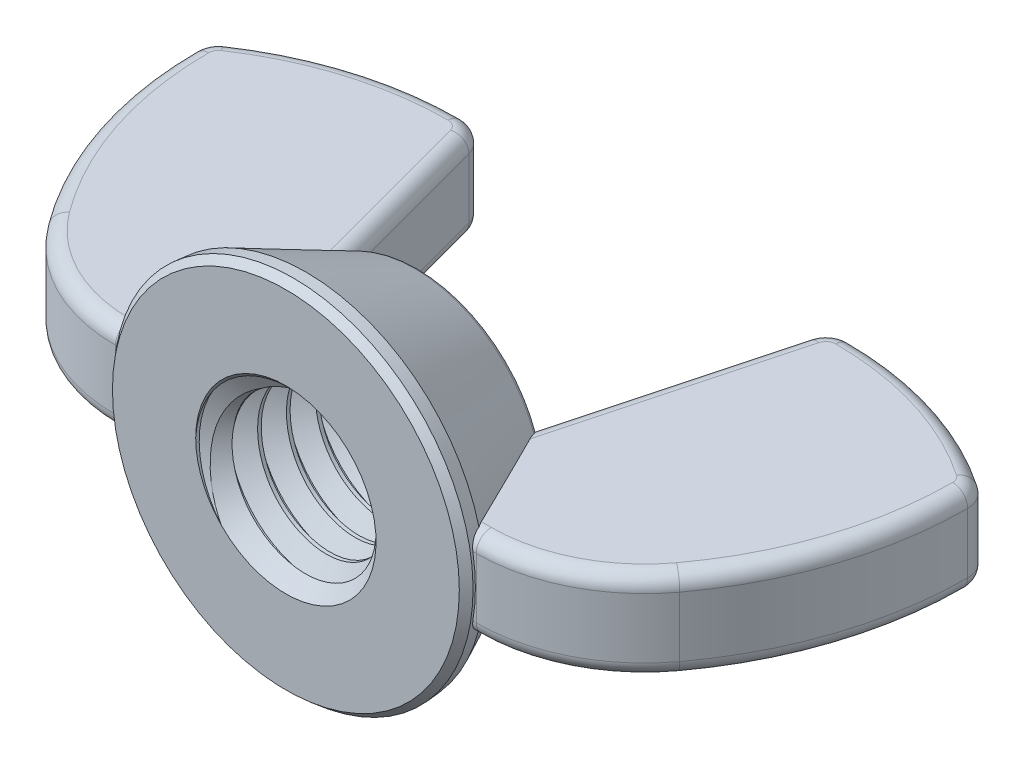
from build123d import *

# Parameters (mm, degrees)
EXTRUDE2_DEPTH     = 1.25
SKETCH3_R          = 5
EXTRUDE1_DEPTH     = 0.55566
EXTRUDE1_DRAFT     = -5
SKETCH15_R         = 4.951386049
EXTRUDE3_DEPTH     = 3.14874
EXTRUDE3_TAPER     = 25.210033151
FILLET3_R          = 0.254
SKETCH4_R          = 2.5
CUT_EXTRUDE1_DEPTH = 16.684929072
SWEEP1_PITCH       = 0.8
SKETCH7_R          = 5
CUT_EXTRUDE2_DEPTH = 16.684929104
SKETCH8_R          = 4.951386049
CUT_EXTRUDE3_DEPTH = 14.546328962
SKETCH11_R         = 2.4492
CUT_EXTRUDE5_DEPTH = 14.546328926
CUT_EXTRUDE5_TAPER = 45
CHAMFER1_SIZE      = 0.2083725
CHAMFER1_SIZE2     = 0.192340809
FILLET4_R          = 0.416666667


with BuildPart() as part:
    # Sketch13 → Extrude2 (new, symmetric)
    with BuildSketch(Plane(origin=(0, 0, 0), x_dir=(1, 0, 0), z_dir=(0, 1, 0))):
        with BuildLine():
            Line((3.074810737, 0.27783), (5, 0.27783))
            ThreePointArc((5, 0.27783), (7.099129938, 0.776746992), (8.749295866, 2.166789103))
            ThreePointArc((8.749295866, 2.166789103), (10.222034162, 5.009156698), (10.73, 8.169850029))
            ThreePointArc((10.73, 8.169850029), (10.648713606, 8.495871948), (10.423883961, 8.745570566))
            ThreePointArc((10.423883961, 8.745570566), (8.013491694, 9.895268701), (5.372282902, 10.29))
            ThreePointArc((5.372282902, 10.29), (4.94953191, 10.146495375), (4.701501078, 9.775291004))
            Line((4.701501078, 9.775291004), (3.074810737, 3.7044))
            Line((3.074810737, 3.7044), (3.074810737, 0.27783))
        make_face()
    extrude(amount=EXTRUDE2_DEPTH, both=True)

    # Fillet4
    fillet4_edges = [part.edges().sort_by_distance(p)[0] for p in [
        (7.099129938, 1.25, -0.776746992),
        (10.222034162, 1.25, -5.009156698),
        (10.648713606, 1.25, -8.495871948),
        (8.013491694, 1.25, -9.895268701),
        (4.94953191, 1.25, -10.146495375),
        (3.888155907, 1.25, -6.739845502),
        (3.888155907, -1.25, -6.739845502),
        (4.037405368, 1.25, -0.27783),
        (4.94953191, -1.25, -10.146495375),
        (8.013491694, -1.25, -9.895268701),
        (10.648713606, -1.25, -8.495871948),
        (10.222034162, -1.25, -5.009156698),
        (7.099129938, -1.25, -0.776746992),
        (4.037405368, -1.25, -0.27783),
    ]]
    fillet(fillet4_edges, radius=FILLET4_R)


with BuildPart() as body_2:
    # Sketch3 → Extrude1 (with draft: the straight prism first)
    with BuildSketch(Plane.XY):
        Circle(SKETCH3_R)
    extrude(amount=-EXTRUDE1_DEPTH)
    # Extrude1: the draft: its side faces are tilted about the plane it starts from
    extrude1_sides = [body_2.faces().sort_by_distance(p)[0] for p in [
        (-5, 0, -0.27783),
    ]]
    draft(extrude1_sides, Plane.XY, EXTRUDE1_DRAFT)

    # Sketch15 → Extrude3 (add)
    with BuildSketch(Plane(origin=(0, 0, -0.55566), x_dir=(-1, 0, 0), z_dir=(0, 0, -1))):
        Circle(SKETCH15_R)
    extrude(amount=EXTRUDE3_DEPTH, taper=EXTRUDE3_TAPER)

    # Fillet3
    fillet3_edges = [body_2.edges().sort_by_distance(p)[0] for p in [
        (3.469027946, 0, -3.7044),
    ]]
    fillet(fillet3_edges, radius=FILLET3_R)

    # Sketch4 → Cut-Extrude1 (cut, through all)
    with BuildSketch(Plane.XY):
        Circle(SKETCH4_R)
    extrude(amount=-CUT_EXTRUDE1_DEPTH, mode=Mode.SUBTRACT)

    # Sweep1: the profile of Sketch6 profile screwed along a right-hand helix of 7.1305 turns, 6 arcs to a turn; built about Z, then put on its axis
    sweep1_z = Axis((0, 0, 0), (0, 0, 1))
    sweep1_corners = [(2.5003, 0, -0.700173205), (1.980384758, 0, -0.4), (1.980384758, 0, -0.3), (2.5003, 0, 0.000173205)]
    with BuildLine(mode=Mode.PRIVATE) as sweep1_profile:
        Line(sweep1_corners[0], sweep1_corners[1])
        Line(sweep1_corners[1], sweep1_corners[2])
        Line(sweep1_corners[2], sweep1_corners[3])
        Line(sweep1_corners[3], sweep1_corners[0])
    sweep1_cap = Face(sweep1_profile.wire())
    sweep1_turn_angles = [0, 30, 60, 90, 120, 150, 180, 210, 240, 270, 300, 330, 360]
    sweep1_turn_weights = [1, 0.8660254037844387, 1, 0.8660254037844387, 1, 0.8660254037844387, 1, 0.8660254037844387, 1, 0.8660254037844387, 1, 0.8660254037844387, 1]
    sweep1_turn_rails = [Edge.make_bspline([Vector(p[0], p[1], 0).rotate(sweep1_z, sweep1_turn_angles[k]) / sweep1_turn_weights[k] + Vector(0, 0, p[2] + SWEEP1_PITCH * sweep1_turn_angles[k] / 360) for k in range(13)], [0, 0, 0, 1, 1, 2, 2, 3, 3, 4, 4, 5, 5, 6, 6, 6], 2, sweep1_turn_weights) for p in sweep1_corners]
    sweep1_turn_sides = [Face.make_surface_from_curves(sweep1_turn_rails[p[0]], sweep1_turn_rails[p[1]]) for p in [(0, 1), (1, 2), (2, 3), (3, 0)]]
    sweep1_last_angles = [2520, 2543.49, 2566.98]
    sweep1_last_weights = [1, 0.9171296552585513, 1]
    sweep1_last_rails = [Edge.make_bspline([Vector(p[0], p[1], 0).rotate(sweep1_z, sweep1_last_angles[k]) / sweep1_last_weights[k] + Vector(0, 0, p[2] + SWEEP1_PITCH * sweep1_last_angles[k] / 360) for k in range(3)], [0, 0, 0, 1, 1, 1], 2, sweep1_last_weights) for p in sweep1_corners]
    sweep1_last_sides = [Face.make_surface_from_curves(sweep1_last_rails[p[0]], sweep1_last_rails[p[1]]) for p in [(0, 1), (1, 2), (2, 3), (3, 0)]]
    sweep1 = Plane(origin=(0, 0, 0), x_dir=(-1, 0, 0), z_dir=(0, 0, -1)) * Solid(Shell([*[p.moved(Location((0, 0, SWEEP1_PITCH * i))) for i in range(7) for p in sweep1_turn_sides], *sweep1_last_sides, sweep1_cap, sweep1_cap.rotate(sweep1_z, 2566.98).moved(Location((0, 0, SWEEP1_PITCH * 2566.98 / 360)))]))
    add(sweep1)

    # Sketch7 → Cut-Extrude2 (cut, through all)
    with BuildSketch(Plane.XY):
        Circle(SKETCH7_R)
    extrude(amount=CUT_EXTRUDE2_DEPTH, mode=Mode.SUBTRACT)

    # Sketch8 → Cut-Extrude3 (cut, through all)
    with BuildSketch(Plane.XY.offset(-3.7044)):
        Circle(SKETCH8_R)
    extrude(amount=-CUT_EXTRUDE3_DEPTH, mode=Mode.SUBTRACT)

    # Cut-Extrude4 cone 1 section (through the dimple's axis) → Cut-Extrude4 (revolve, cut)
    with BuildSketch(Plane(origin=(0, 0, 0), x_dir=(0, -1, 0), z_dir=(1, 0, 0))):
        Polygon((0, 0), (2.5, 0), (0, 2.5), align=None)
    revolve(axis=Axis((0, 0, 0), (0, 0, -1)), mode=Mode.SUBTRACT)

    # Sketch11 → Cut-Extrude5 (cut, through all)
    with BuildSketch(Plane.XY.offset(-3.7044)):
        Circle(SKETCH11_R)
    extrude(amount=CUT_EXTRUDE5_DEPTH, taper=CUT_EXTRUDE5_TAPER, mode=Mode.SUBTRACT)

    # Chamfer1
    chamfer1_edges = [body_2.edges().sort_by_distance(p)[0] for p in [
        (-5, 0, 0),
    ]]
    chamfer1_side = [body_2.faces().sort_by_distance(p)[0] for p in [
        (-4.975693025, 0, -0.27783),
    ]]
    chamfer(chamfer1_edges, length=CHAMFER1_SIZE, length2=CHAMFER1_SIZE2, reference=chamfer1_side[0])


with BuildPart() as body_3:
    # Mirror6: mirrored copy
    add(part.part.mirror(Plane(origin=(0, 0, 0), x_dir=(0, 0, 1), z_dir=(1, 0, 0))))

    # Combine2: union part, body 2
    add(part.part)
    add(body_2.part)


solid = body_3.part
